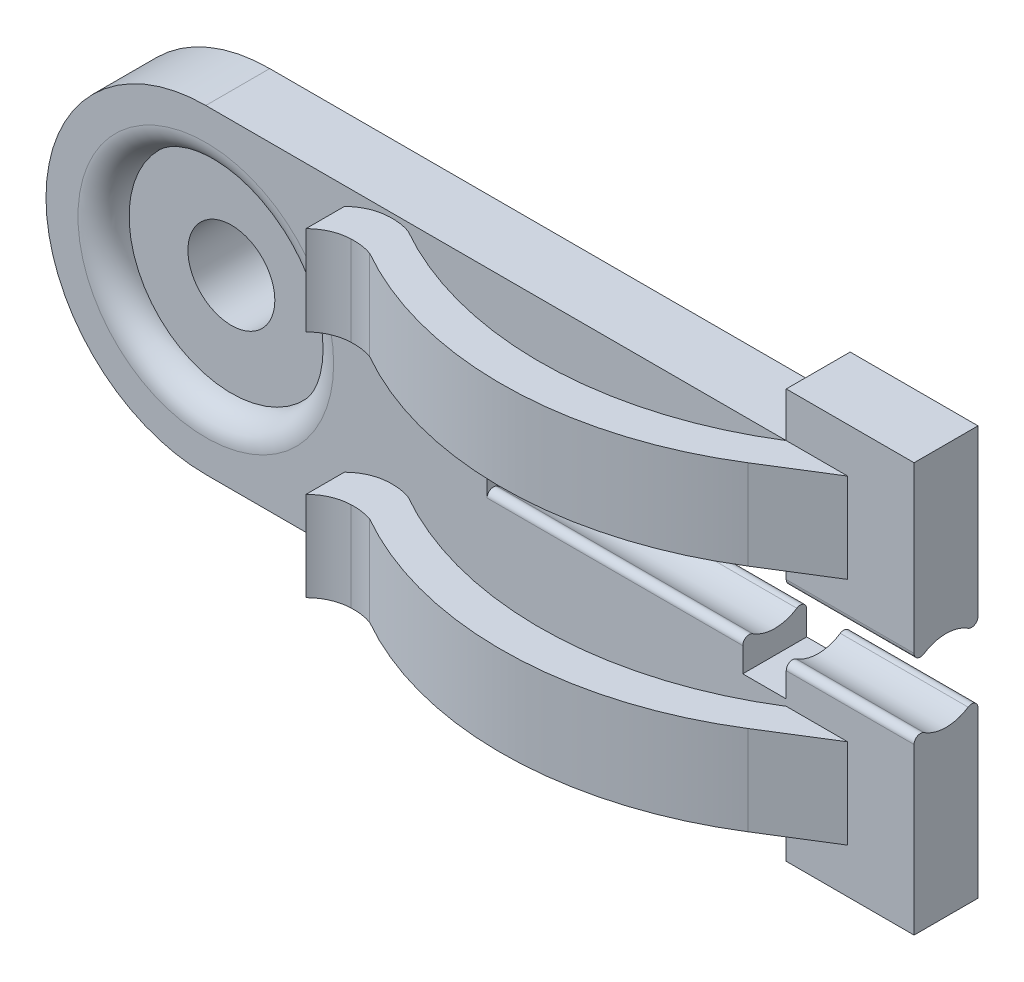
from build123d import *

# Parameters (mm, degrees)
SKETCH1_R           = 1.7
SKETCH1_W           = 10
SKETCH1_H           = 12.5
BOSS_EXTRUDE1_DEPTH = 2.5
SKETCH2_W           = 5
SKETCH2_H           = 16
BOSS_EXTRUDE2_DEPTH = 2.5
SKETCH3_W           = 1.7
SKETCH3_H           = 5
CUT_EXTRUDE1_DEPTH  = 29.940283343
SKETCH6_R           = 1.59
CUT_EXTRUDE3_DEPTH  = 16.7
BOSS_EXTRUDE3_DEPTH = 3.5
BOSS_EXTRUDE5_DEPTH = 3.5
SKETCH10_R          = 4
BOSS_EXTRUDE6_DEPTH = 1.875
SKETCH11_R          = 1.7
CUT_EXTRUDE4_DEPTH  = 30.481567746
SKETCH12_R          = 4
CUT_EXTRUDE5_DEPTH  = 1
FILLET1_R           = 1
FILLET2_R           = 1
FILLET3_R           = 0.25
FILLET4_R           = 0.25


with BuildPart() as part:
    # Sketch1 → Boss-Extrude1 (new body)
    # profile 1 of 2: a face of its own
    with BuildSketch(Plane.XY):
        with BuildLine():
            ThreePointArc((0, 6.25), (-6.25, 0), (0, -6.25))
            Line((0, -6.25), (12.7, -6.25))
            Line((12.7, -6.25), (12.7, 6.25))
            Line((12.7, 6.25), (0, 6.25))
        make_face()
        Circle(SKETCH1_R, mode=Mode.SUBTRACT)
    # profile 2 of 2: a face of its own
    with BuildSketch(Plane.XY):
        with Locations((17.7, 0)):
            Rectangle(SKETCH1_W, SKETCH1_H)
    extrude(amount=BOSS_EXTRUDE1_DEPTH)

    # Sketch2 → Boss-Extrude2 (add)
    with BuildSketch(Plane.XY.offset(2.5)):
        with Locations((25.2, 0)):
            Rectangle(SKETCH2_W, SKETCH2_H)
    extrude(amount=-BOSS_EXTRUDE2_DEPTH)

    # Sketch3 → Cut-Extrude1 (cut, through all)
    with BuildSketch(Plane.XY.offset(2.5)):
        with Locations((21.85, 0)):
            Rectangle(SKETCH3_W, SKETCH3_H)
    extrude(amount=-CUT_EXTRUDE1_DEPTH, mode=Mode.SUBTRACT)

    # Sketch6 → Cut-Extrude3 (cut)
    with BuildSketch(Plane(origin=(27.7, 0, 0), x_dir=(0, 0, -1), z_dir=(1, 0, 0))):
        with Locations((-1.25, 0)):
            Circle(SKETCH6_R)
    extrude(amount=-CUT_EXTRUDE3_DEPTH, mode=Mode.SUBTRACT)


with BuildPart() as body_2:
    # Sketch7 → Boss-Extrude3 (new body)
    with BuildSketch(Plane.XZ.offset(6.25)):
        with BuildLine():
            Line((6.129900512, 3.210673711), (6.129900512, 4.710673711))
            ThreePointArc((6.129900512, 4.710673711), (6.694341527, 4.327552018), (7.360579964, 4.180915603))
            ThreePointArc((7.360579964, 4.180915603), (7.789326283, 4.199870579), (8.206709695, 4.299739418))
            ThreePointArc((8.206709695, 4.299739418), (15.494742209, 6.151071465), (22.7, 4))
            Line((22.7, 4), (22.7, 2.5))
            ThreePointArc((22.7, 2.5), (15.494742209, 4.651071465), (8.206709695, 2.799739418))
            ThreePointArc((8.206709695, 2.799739418), (7.789326283, 2.699870579), (7.360579964, 2.680915603))
            ThreePointArc((7.360579964, 2.680915603), (6.694341527, 2.827552018), (6.129900512, 3.210673711))
        make_face()
    extrude(amount=-BOSS_EXTRUDE3_DEPTH)


with BuildPart() as body_3:
    # Sketch9 → Boss-Extrude5 (new body)
    with BuildSketch(Plane.XZ.offset(6.25)):
        Polygon((22.7, 4), (25.104907101, 2.5), (22.7, 2.5), align=None)
    extrude(amount=-BOSS_EXTRUDE5_DEPTH)

    # Combine1: union body 2
    add(body_2.part)


with BuildPart() as body_3_2:
    # Mirror5: mirrored copy
    add(body_3.part.mirror(Plane(origin=(0, 0, 0), x_dir=(0, 0, 1), z_dir=(0, -1, 0))))


with BuildPart() as part_1:
    add(part.part)

    # Combine4: union body 3, body 3 2
    add(body_3.part)
    add(body_3_2.part)

    # Sketch10 → Boss-Extrude6 (add)
    with BuildSketch(Plane(origin=(0, 0, 0), x_dir=(-1, 0, 0), z_dir=(0, 0, -1))):
        with Locations(Location((0, 0, 0), (0, 0, 180))):
            Circle(SKETCH10_R)
    extrude(amount=BOSS_EXTRUDE6_DEPTH)

    # Sketch11 → Cut-Extrude4 (cut, through all)
    with BuildSketch(Plane.XY):
        Circle(SKETCH11_R)
    extrude(amount=-CUT_EXTRUDE4_DEPTH, mode=Mode.SUBTRACT)

    # Sketch12 → Cut-Extrude5 (cut)
    with BuildSketch(Plane.XY.offset(2.5)):
        Circle(SKETCH12_R)
    extrude(amount=-CUT_EXTRUDE5_DEPTH, mode=Mode.SUBTRACT)

    # Fillet1
    fillet1_edges = [part_1.edges().sort_by_distance(p)[0] for p in [
        (-4, 0, 2.5),
    ]]
    fillet(fillet1_edges, radius=FILLET1_R - 0.0001)  # a hair under: the kernel refuses the full size

    # Fillet2
    fillet2_edges = [part_1.edges().sort_by_distance(p)[0] for p in [
        (-4, 0, -1.875),
    ]]
    fillet(fillet2_edges, radius=FILLET2_R)

    # Fillet3
    fillet3_edges = [part_1.edges().sort_by_distance(p)[0] for p in [
        (16, 0.98264948, 2.5),
        (16, -0.98264948, 2.5),
        (16, 0.98264948, 0),
        (16, -0.98264948, 0),
    ]]
    fillet(fillet3_edges, radius=FILLET3_R)

    # Fillet4
    fillet4_edges = [part_1.edges().sort_by_distance(p)[0] for p in [
        (25.2, 0.98264948, 2.5),
        (25.2, -0.98264948, 2.5),
        (25.2, 0.98264948, 0),
        (25.2, -0.98264948, 0),
    ]]
    fillet(fillet4_edges, radius=FILLET4_R)


solid = part_1.part
